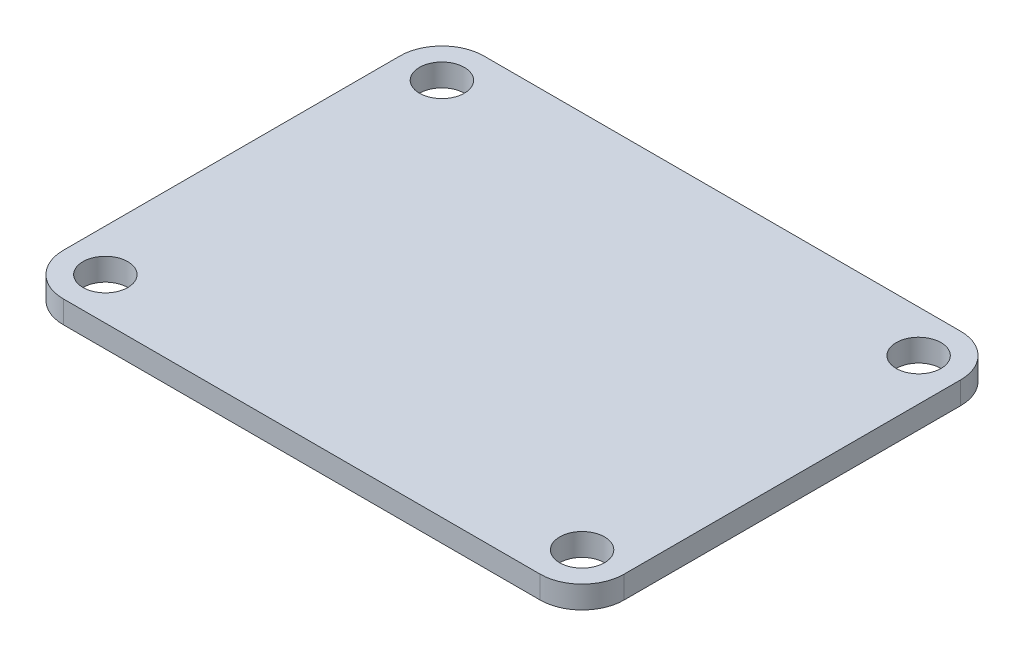
from build123d import *

# Parameters (mm, degrees)
SKETCH_1_R      = 1.6
EXTRUDE_1_DEPTH = 1.6


with BuildPart() as part:
    # Эскиз1 → Бобышка-Вытянуть1 (new body)
    with BuildSketch(Plane(origin=(0, 0, 0), x_dir=(1, 0, 0), z_dir=(0, 1, 0))):
        with BuildLine():
            Line((-17, 15), (17, 15))
            ThreePointArc((17, 15), (19.121320344, 14.121320344), (20, 12))
            Line((20, 12), (20, -12))
            ThreePointArc((20, -12), (19.121320344, -14.121320344), (17, -15))
            Line((17, -15), (-17, -15))
            ThreePointArc((-17, -15), (-19.121320344, -14.121320344), (-20, -12))
            Line((-20, -12), (-20, 12))
            ThreePointArc((-20, 12), (-19.121320344, 14.121320344), (-17, 15))
        make_face()
        with Locations((-17, 12)):
            Circle(SKETCH_1_R, mode=Mode.SUBTRACT)
        with Locations((17, 12)):
            Circle(SKETCH_1_R, mode=Mode.SUBTRACT)
        with Locations((17, -12)):
            Circle(SKETCH_1_R, mode=Mode.SUBTRACT)
        with Locations((-17, -12)):
            Circle(SKETCH_1_R, mode=Mode.SUBTRACT)
    extrude(amount=EXTRUDE_1_DEPTH)


solid = part.part
